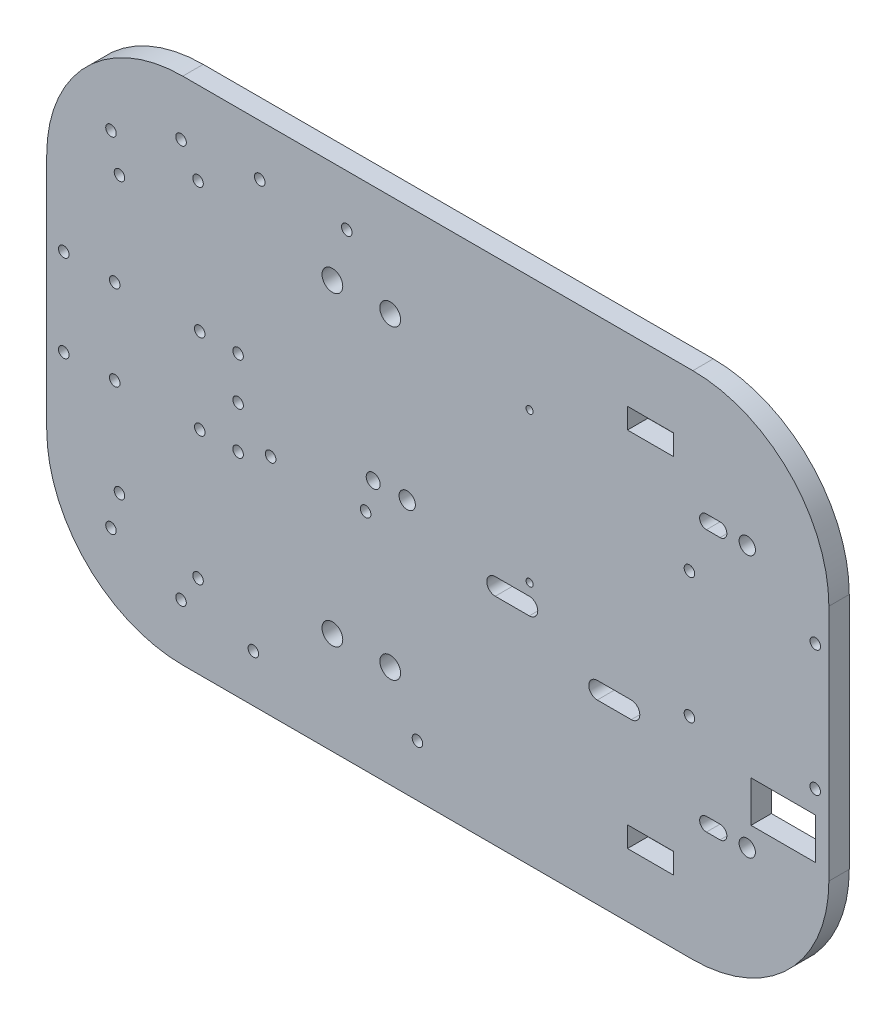
from build123d import *

# Parameters (mm, degrees)
ESBO_O1_R                   = 1.55
ESBO_O1_R_2                 = 2.4
ESBO_O1_R_3                 = 1.05
ESBO_O1_W                   = 18.9
ESBO_O1_H                   = 12.1
ESBO_O1_W_2                 = 13.55
ESBO_O1_H_2                 = 6.05
RESSALTO_EXTRUS_O1_DEPTH    = 6
CORTE_EXTRUS_O1_START       = -6
CORTE_EXTRUS_O1_OUTLINE_R   = 2.999999997
CORTE_EXTRUS_O1_OUTLINE_R_2 = 2.55
CORTE_EXTRUS_O1_OUTLINE_R_3 = 1.55
CORTE_EXTRUS_O1_DEPTH       = 6
RESSALTO_EXTRUS_O2_DEPTH    = 6
CORTE_EXTRUS_O2_DEPTH       = 6
ESBO_O5_R                   = 2.05
CORTE_EXTRUS_O3_DEPTH       = 6
RESSALTO_EXTRUS_O3_DEPTH    = 6
ESBO_O8_W                   = 50
ESBO_O8_H                   = 9.999552213
ESBO_O8_H_2                 = 10.000447787
RESSALTO_EXTRUS_O4_DEPTH    = 6
ESBO_O9_R                   = 3.05
CORTE_EXTRUS_O4_DEPTH       = 6
ESBO_O10_R                  = 1.05
RESSALTO_EXTRUS_O5_DEPTH    = 6
ESBO_O11_R                  = 1.05
CORTE_EXTRUS_O5_DEPTH       = 6


# Read off the part's stored shape, not the designer's step: Corte-extrusão1
with BuildPart() as part:
    # Esboço1 → Ressalto-extrusão1 (new body)
    with BuildSketch(Plane.XY):
        with BuildLine():
            Line((-57.793944221, 57.049862318), (92.206055779, 57.049862318))
            ThreePointArc((92.206055779, 57.049862318), (120.490327027, 45.334133565), (132.206055779, 17.049862318))
            Line((132.206055779, 17.049862318), (132.206055779, -52.950137682))
            ThreePointArc((132.206055779, -52.950137682), (120.490327027, -81.234408929), (92.206055779, -92.950137682))
            Line((92.206055779, -92.950137682), (-57.793944221, -92.950137682))
            ThreePointArc((-57.793944221, -92.950137682), (-86.078215468, -81.234408929), (-97.793944221, -52.950137682))
            Line((-97.793944221, -52.950137682), (-97.793944221, 17.049862318))
            ThreePointArc((-97.793944221, 17.049862318), (-86.078215468, 45.334133565), (-57.793944221, 57.049862318))
        make_face()
        with Locations((91.206055779, 5.549862318)):
            Circle(ESBO_O1_R, mode=Mode.SUBTRACT)
        with Locations((-78.899831671, -68.557958731)):
            Circle(ESBO_O1_R, mode=Mode.SUBTRACT)
        with Locations((91.206055779, -31.450137682)):
            Circle(ESBO_O1_R, mode=Mode.SUBTRACT)
        with Locations((-53.299831671, -68.557958731)):
            Circle(ESBO_O1_R, mode=Mode.SUBTRACT)
        with Locations((128.206055779, -31.450137682)):
            Circle(ESBO_O1_R, mode=Mode.SUBTRACT)
        with Locations((-77.788996209, -5.451057304)):
            Circle(ESBO_O1_R, mode=Mode.SUBTRACT)
        with Locations((11.222430841, -77.710137682)):
            Circle(ESBO_O1_R, mode=Mode.SUBTRACT)
        with Locations((-37.037569159, -78.980137682)):
            Circle(ESBO_O1_R, mode=Mode.SUBTRACT)
        with Locations((-31.957569159, -26.910137682)):
            Circle(ESBO_O1_R, mode=Mode.SUBTRACT)
        with Locations((-4.017569159, -26.910137682)):
            Circle(ESBO_O1_R, mode=Mode.SUBTRACT)
        with Locations((128.206055779, 5.549862318)):
            Circle(ESBO_O1_R, mode=Mode.SUBTRACT)
        with Locations((-92.793944221, -30.750137682)):
            Circle(ESBO_O1_R, mode=Mode.SUBTRACT)
        with Locations((-92.793944221, -5.150137682)):
            Circle(ESBO_O1_R, mode=Mode.SUBTRACT)
        with Locations((-76.401765269, 22.555749768)):
            Circle(ESBO_O1_R, mode=Mode.SUBTRACT)
        with Locations((-52.788996209, -5.451057304)):
            Circle(ESBO_O1_R, mode=Mode.SUBTRACT)
        with Locations((-52.788996209, -30.451057304)):
            Circle(ESBO_O1_R, mode=Mode.SUBTRACT)
        with Locations((-77.788996209, -30.451057304)):
            Circle(ESBO_O1_R, mode=Mode.SUBTRACT)
        with Locations((-78.899831671, 32.657683367)):
            Circle(ESBO_O1_R, mode=Mode.SUBTRACT)
        with Locations((-53.299831671, 32.657683367)):
            Circle(ESBO_O1_R, mode=Mode.SUBTRACT)
        with Locations((-58.299831671, 40.657683367)):
            Circle(ESBO_O1_R, mode=Mode.SUBTRACT)
        with Locations((-58.299831671, -76.557958731)):
            Circle(ESBO_O1_R, mode=Mode.SUBTRACT)
        with Locations((-76.401765269, -58.456025132)):
            Circle(ESBO_O1_R, mode=Mode.SUBTRACT)
        with Locations((-35.15079847, 31.606716567)):
            Circle(ESBO_O1_R, mode=Mode.SUBTRACT)
        with Locations((-9.55079847, 31.606716567)):
            Circle(ESBO_O1_R, mode=Mode.SUBTRACT)
        with Locations((108.206055779, -56.450137682)):
            Circle(ESBO_O1_R_2, mode=Mode.SUBTRACT)
        with Locations((108.206055779, 20.549862318)):
            Circle(ESBO_O1_R_2, mode=Mode.SUBTRACT)
        with Locations((44.206055779, -19.950137682)):
            Circle(ESBO_O1_R_3, mode=Mode.SUBTRACT)
        with Locations((8.206055779, -17.950137682)):
            Circle(ESBO_O1_R_2, mode=Mode.SUBTRACT)
        with Locations((44.206055779, 24.049862318)):
            Circle(ESBO_O1_R_3, mode=Mode.SUBTRACT)
        with Locations((-41.520254265, -30.451057304)):
            Circle(ESBO_O1_R, mode=Mode.SUBTRACT)
        with Locations((-41.520254265, -17.951057304)):
            Circle(ESBO_O1_R, mode=Mode.SUBTRACT)
        with Locations((-41.520254265, -5.451057304)):
            Circle(ESBO_O1_R, mode=Mode.SUBTRACT)
        with BuildLine():
            Line((74.102198496, -40.878145103), (64.102198496, -40.878145103))
            ThreePointArc((64.102198496, -40.878145103), (61.602198496, -38.378145103), (64.102198496, -35.878145103))
            Line((64.102198496, -35.878145103), (74.102198496, -35.878145103))
            ThreePointArc((74.102198496, -35.878145103), (76.602198496, -38.378145103), (74.102198496, -40.878145103))
        make_face(mode=Mode.SUBTRACT)
        with BuildLine():
            Line((96.206055779, 22.549862318), (100.206055779, 22.549862318))
            ThreePointArc((100.206055779, 22.549862318), (102.206055779, 20.549862318), (100.206055779, 18.549862318))
            Line((100.206055779, 18.549862318), (96.206055779, 18.549862318))
            ThreePointArc((96.206055779, 18.549862318), (94.206055779, 20.549862318), (96.206055779, 22.549862318))
        make_face(mode=Mode.SUBTRACT)
        with BuildLine():
            Line((96.206055779, -54.450137682), (100.206055779, -54.450137682))
            ThreePointArc((100.206055779, -54.450137682), (102.206055779, -56.450137682), (100.206055779, -58.450137682))
            Line((100.206055779, -58.450137682), (96.206055779, -58.450137682))
            ThreePointArc((96.206055779, -58.450137682), (94.206055779, -56.450137682), (96.206055779, -54.450137682))
        make_face(mode=Mode.SUBTRACT)
        with Locations((118.766338719, -44.142882399)):
            Rectangle(ESBO_O1_W, ESBO_O1_H, mode=Mode.SUBTRACT)
        with Locations((79.761339118, 35.337517738)):
            Rectangle(ESBO_O1_W_2, ESBO_O1_H_2, mode=Mode.SUBTRACT)
        with Locations((79.761339118, -71.237793102)):
            Rectangle(ESBO_O1_W_2, ESBO_O1_H_2, mode=Mode.SUBTRACT)
    extrude(amount=RESSALTO_EXTRUS_O1_DEPTH)

    # Corte-extrusão1 outline → Corte-extrusão1 (cut)
    with BuildSketch(Plane.XY.offset(6).offset(CORTE_EXTRUS_O1_START)):
        with Locations((-17.788996212, -62.950585469)):
            Circle(CORTE_EXTRUS_O1_OUTLINE_R)
        with Locations((7.211003788, -62.950585469)):
            Circle(CORTE_EXTRUS_O1_OUTLINE_R)
        with Locations((-17.788996212, 27.049414531)):
            Circle(CORTE_EXTRUS_O1_OUTLINE_R)
        with Locations((7.211003788, 27.049414531)):
            Circle(CORTE_EXTRUS_O1_OUTLINE_R)
        with Locations((0.411003785, -17.950228357)):
            Circle(CORTE_EXTRUS_O1_OUTLINE_R_2)
        with Locations((-35.15079847, 42.049862318)):
            Circle(CORTE_EXTRUS_O1_OUTLINE_R_3)
        with Locations((-9.55079847, 42.049862318)):
            Circle(CORTE_EXTRUS_O1_OUTLINE_R_3)
    extrude(amount=CORTE_EXTRUS_O1_DEPTH, mode=Mode.SUBTRACT)

    # Esboço3 → Ressalto-extrusão2 (add)
    with BuildSketch(Plane.XY.offset(6)):
        Polygon((-14.016641423, 28.740365826), (0, 28.740365826), (0, 35.849208008), (-40.162042527, 35.849208008), (-40.162042527, 28.740365826), (-25.883056006, 28.740365826), (-25.883056006, 31.312651868), (-14.016641423, 31.312651868), align=None)
    extrude(amount=-RESSALTO_EXTRUS_O2_DEPTH)

    # Esboço4 → Corte-extrusão2 (cut)
    with BuildSketch(Plane.XY.offset(6)):
        with BuildLine():
            Line((44.103196828, -24.450137682), (34.103196828, -24.450137682))
            ThreePointArc((34.103196828, -24.450137682), (31.603196828, -26.950137682), (34.103196828, -29.450137682))
            Line((34.103196828, -29.450137682), (44.103196828, -29.450137682))
            ThreePointArc((44.103196828, -29.450137682), (46.603196828, -26.950137682), (44.103196828, -24.450137682))
        make_face()
    extrude(amount=-CORTE_EXTRUS_O2_DEPTH, mode=Mode.SUBTRACT)

    # Esboço5 → Corte-extrusão3 (cut)
    with BuildSketch(Plane.XY.offset(6)):
        with Locations((-1.793944221, -17.950137682)):
            Circle(ESBO_O5_R)
    extrude(amount=-CORTE_EXTRUS_O3_DEPTH, mode=Mode.SUBTRACT)

    # Esboço6 → Ressalto-extrusão3 (add)
    with BuildSketch(Plane.XY.offset(6)):
        with BuildLine():
            ThreePointArc((0.256055779, -17.950137682), (-0.344375319, -19.399706583), (-1.793944221, -20.000137682))
            Line((-1.793944221, -20.000137682), (-1.793944221, -22.624881404))
            Line((-1.793944221, -22.624881404), (3.749048886, -22.624881404))
            Line((3.749048886, -22.624881404), (3.749048886, -13.412148233))
            Line((3.749048886, -13.412148233), (-1.793944221, -13.412148233))
            Line((-1.793944221, -13.412148233), (-1.793944221, -15.900137682))
            ThreePointArc((-1.793944221, -15.900137682), (-0.344375319, -16.500568781), (0.256055779, -17.950137682))
        make_face()
    extrude(amount=-RESSALTO_EXTRUS_O3_DEPTH)

    # Esboço8 → Ressalto-extrusão4 (add)
    with BuildSketch(Plane.XY.offset(6)):
        with Locations((-5.288996218, -62.950361576)):
            Rectangle(ESBO_O8_W, ESBO_O8_H)
        with Locations((-5.288996218, 27.049638425)):
            Rectangle(ESBO_O8_W, ESBO_O8_H_2)
    extrude(amount=-RESSALTO_EXTRUS_O4_DEPTH)

    # Esboço9 → Corte-extrusão4 (cut)
    with BuildSketch(Plane.XY.offset(6)):
        with Locations((-13.788996218, -62.950361575)):
            Circle(ESBO_O9_R)
        with Locations((3.211003782, -62.950361575)):
            Circle(ESBO_O9_R)
        with Locations((3.211003782, 27.050086211)):
            Circle(ESBO_O9_R)
        with Locations((-13.788996218, 27.050086211)):
            Circle(ESBO_O9_R)
    extrude(amount=-CORTE_EXTRUS_O4_DEPTH, mode=Mode.SUBTRACT)

    # Esboço10 → Ressalto-extrusão5 (add)
    with BuildSketch(Plane(origin=(0, 0, 0), x_dir=(-1, 0, 0), z_dir=(0, 0, -1))):
        with Locations((-44.206055779, -19.950137682)):
            Circle(ESBO_O10_R)
        with Locations((-44.206055779, 24.049862318)):
            Circle(ESBO_O10_R)
    extrude(amount=-RESSALTO_EXTRUS_O5_DEPTH)

    # Esboço11 → Corte-extrusão5 (cut)
    with BuildSketch(Plane(origin=(0, 0, 0), x_dir=(-1, 0, 0), z_dir=(0, 0, -1))):
        with Locations((-44.206055779, 23.049862318)):
            Circle(ESBO_O11_R)
        with Locations((-44.206055779, -20.950137682)):
            Circle(ESBO_O11_R)
    extrude(amount=-CORTE_EXTRUS_O5_DEPTH, mode=Mode.SUBTRACT)


solid = part.part
